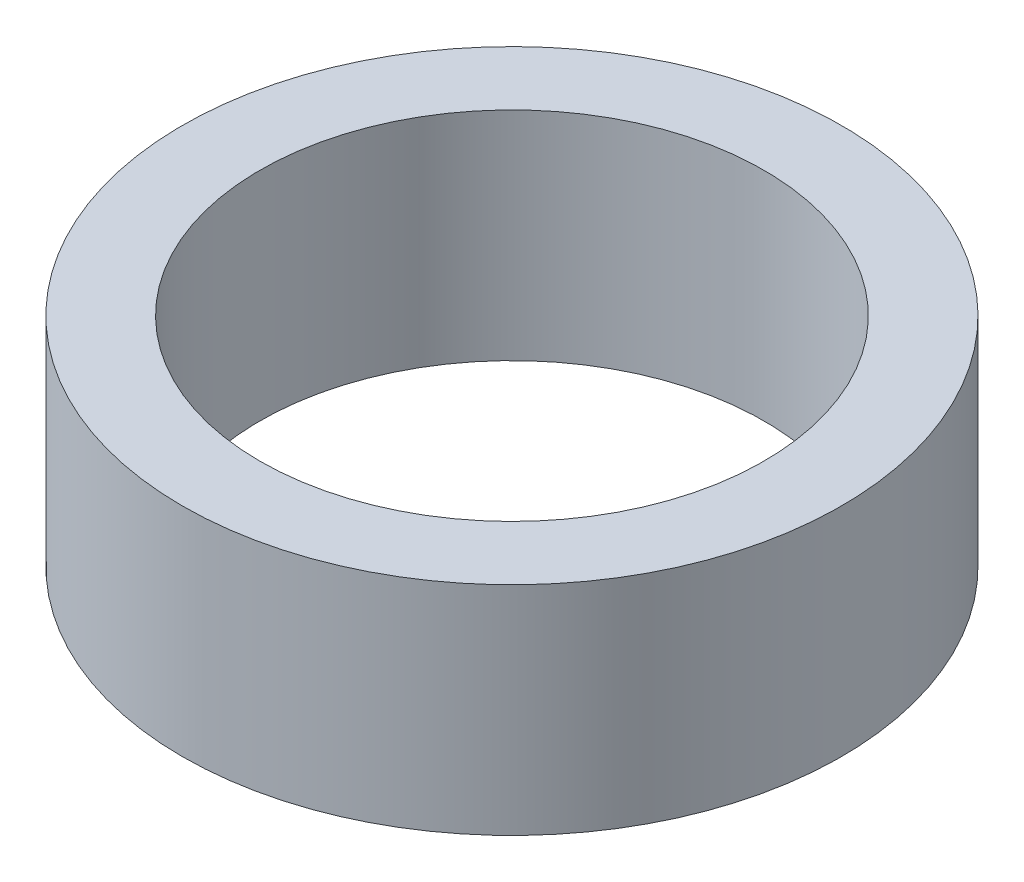
from build123d import *

# Parameters (mm, degrees)
SKETCH1_R           = 42.5
BOSS_EXTRUDE1_DEPTH = 28
SKETCH2_R           = 32.5
CUT_EXTRUDE1_DEPTH  = 67.306108316


with BuildPart() as part:
    # Sketch1 → Boss-Extrude1 (new body)
    with BuildSketch(Plane(origin=(0, 0, 0), x_dir=(1, 0, 0), z_dir=(0, 1, 0))):
        Circle(SKETCH1_R)
    extrude(amount=BOSS_EXTRUDE1_DEPTH)

    # Sketch2 → Cut-Extrude1 (cut, through all)
    with BuildSketch(Plane(origin=(0, 0, 0), x_dir=(1, 0, 0), z_dir=(0, 1, 0))):
        Circle(SKETCH2_R)
    extrude(amount=CUT_EXTRUDE1_DEPTH, mode=Mode.SUBTRACT)


solid = part.part
